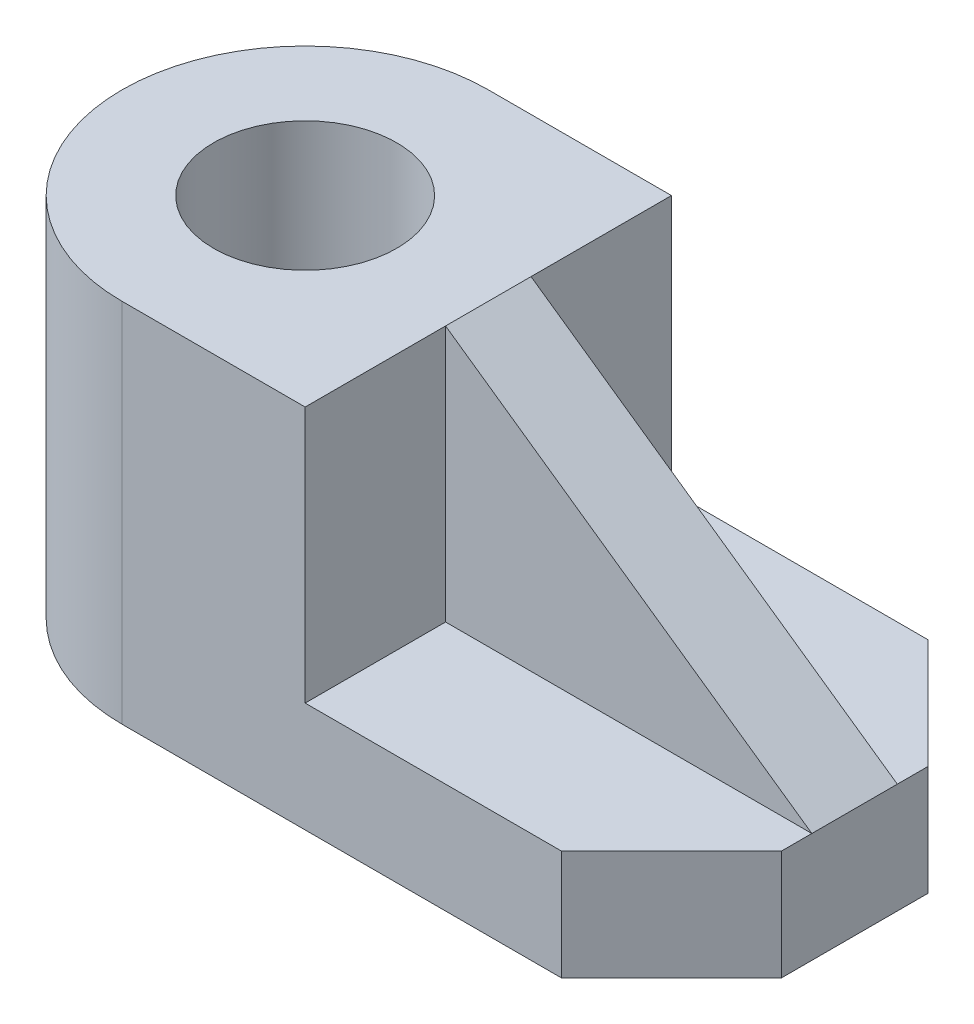
from build123d import *

# Parameters (mm, degrees)
BOSS_EXTRUDE2_DEPTH      = 381
BOSS_EXTRUDE2_DEPTH_BACK = 381
FILLET1_R                = 381
SKETCH2_W                = 762
SKETCH2_H                = 292.1
CUT_EXTRUDE1_DEPTH       = 533.4
SKETCH4_R                = 190.5
CUT_EXTRUDE2_DEPTH       = 1746.961339778
CHAMFER1_SIZE            = 228.6


with BuildPart() as part:
    # Sketch1 → Boss-Extrude2 (new, two sides: drawn at the far end of the back side and taken through both)
    with BuildSketch(Plane.XY.offset(-BOSS_EXTRUDE2_DEPTH_BACK)):
        Polygon((0, 0), (0, 762), (762, 762), (1524, 228.6), (1524, 0), align=None)
    extrude(amount=BOSS_EXTRUDE2_DEPTH + BOSS_EXTRUDE2_DEPTH_BACK)

    # Fillet1
    fillet1_edges = [part.edges().sort_by_distance(p)[0] for p in [
        (0, 381, -381),
        (0, 381, 381),
    ]]
    fillet(fillet1_edges, radius=FILLET1_R - 0.0001)  # a hair under: the kernel refuses the full size

    # Sketch2 → Cut-Extrude1 (cut)
    with BuildSketch(Plane(origin=(0, 762, 0), x_dir=(1, 0, 0), z_dir=(0, 1, 0))):
        with Locations((1143, 234.95)):
            Rectangle(SKETCH2_W, SKETCH2_H)
        with Locations((1143, -234.95)):
            Rectangle(SKETCH2_W, SKETCH2_H)
    extrude(amount=-CUT_EXTRUDE1_DEPTH, mode=Mode.SUBTRACT)

    # Sketch4 → Cut-Extrude2 (cut, through all)
    with BuildSketch(Plane(origin=(0, 762, 0), x_dir=(1, 0, 0), z_dir=(0, 1, 0))):
        with Locations(Location((381, 0, 0), (0, 0, 270))):
            Circle(SKETCH4_R)
    extrude(amount=-CUT_EXTRUDE2_DEPTH, mode=Mode.SUBTRACT)

    # Chamfer1
    chamfer1_edges = [part.edges().sort_by_distance(p)[0] for p in [
        (1524, 114.3, 381),
        (1524, 114.3, -381),
    ]]
    chamfer(chamfer1_edges, length=CHAMFER1_SIZE)


solid = part.part
